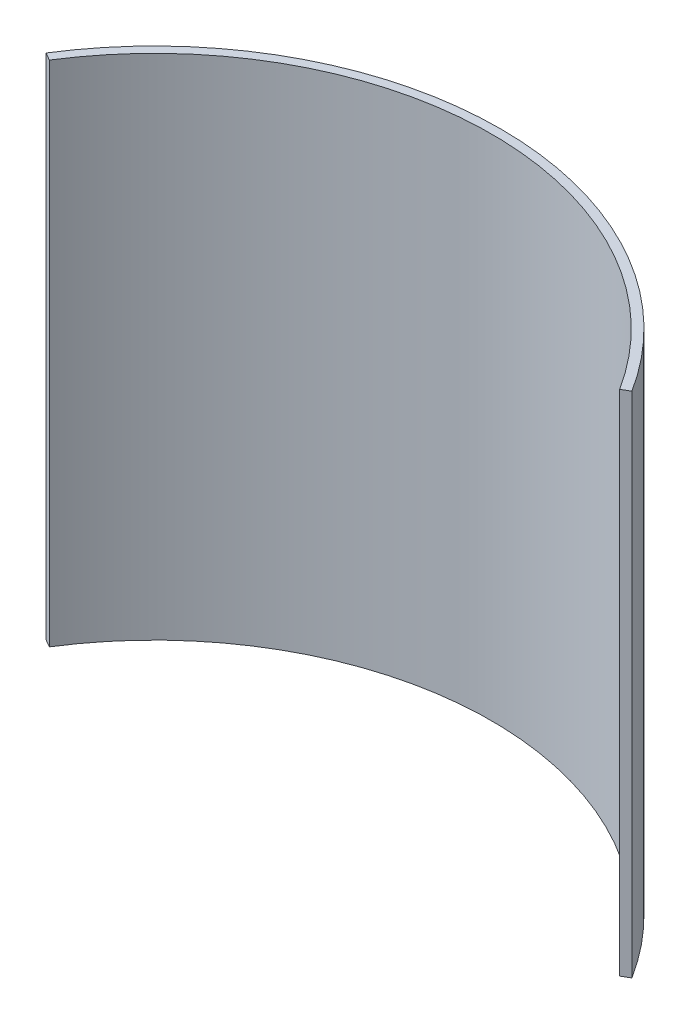
from build123d import *

# Parameters (mm, degrees)
BOSS_EXTRUDE1_DEPTH = 56.5


with BuildPart() as part:
    # Sketch1 → Boss-Extrude1 (new body)
    with BuildSketch(Plane(origin=(0, 0, 0), x_dir=(1, 0, 0), z_dir=(0, 1, 0))):
        with BuildLine():
            Line((-31.699961479, 20.034032101), (-32.566662498, 20.534422167))
            ThreePointArc((-32.566662498, 20.534422167), (0, 38.5), (32.566662498, 20.534422167))
            Line((32.566662498, 20.534422167), (31.699961479, 20.034032101))
            ThreePointArc((31.699961479, 20.034032101), (0, 37.5), (-31.699961479, 20.034032101))
        make_face()
    extrude(amount=-BOSS_EXTRUDE1_DEPTH)


solid = part.part
